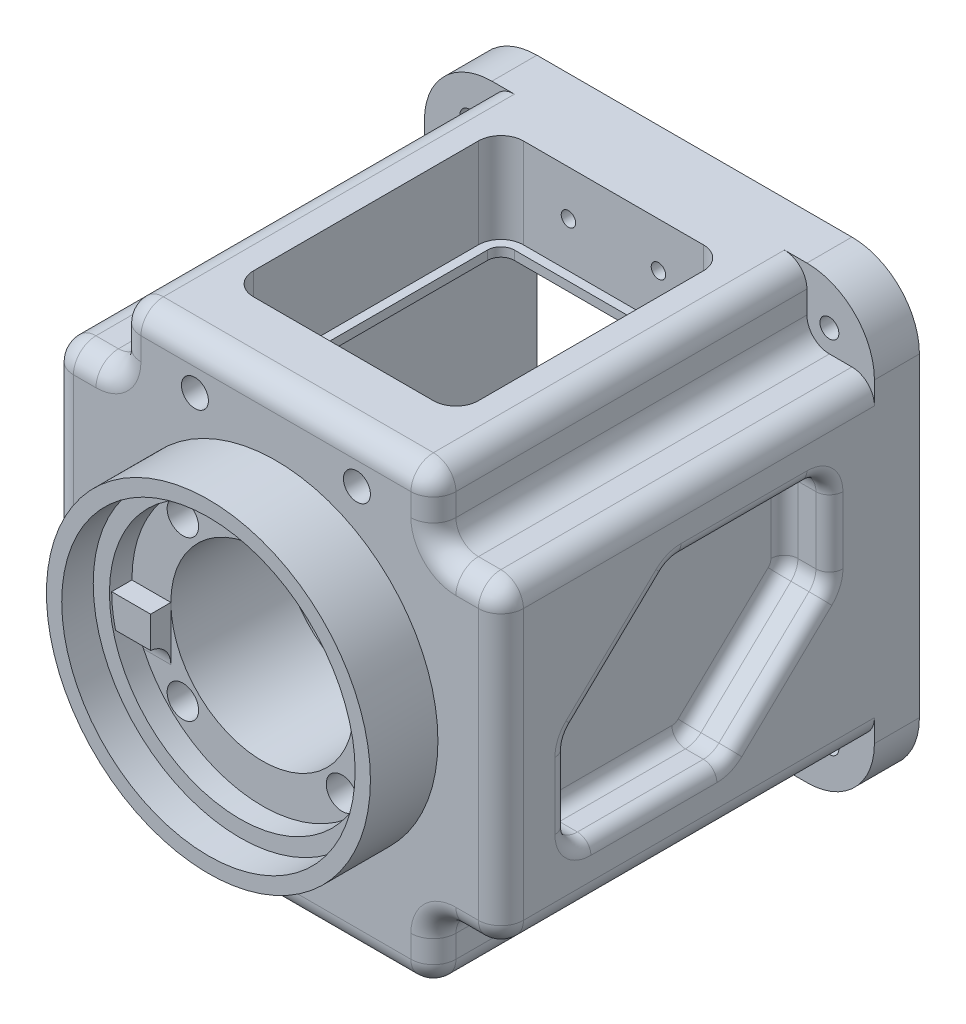
from build123d import *
from build123d.topology import SkipClean

# Parameters (mm, degrees)
SKETCH_1_W           = 100
SKETCH_1_H           = 100
EXTRUDE_1_DEPTH      = 93
FILLET_1_R           = 15
CUT_EXTRUDE_1_DEPTH  = 83
SKETCH_3_R           = 25
SKETCH_3_R_2         = 15
CUT_EXTRUDE_2_DEPTH  = 7
SKETCH_4_R           = 24
SKETCH_4_R_2         = 16
CUT_EXTRUDE_3_DEPTH  = 3
CHAMFER_1_SIZE       = 1
SKETCH_5_R           = 36
EXTRUDE_2_DEPTH      = 15
SKETCH_6_R           = 32.6
CUT_EXTRUDE_4_DEPTH  = 7
SKETCH_7_R           = 29
CUT_EXTRUDE_5_DEPTH  = 5
SKETCH_8_R           = 20.35
SKETCH_8_R_2         = 2.1
CUT_EXTRUDE_6_DEPTH  = 120.230868486
SKETCH_9_R           = 3.5
CUT_EXTRUDE_7_DEPTH  = 8
SKETCH_10_W          = 9
SKETCH_10_H          = 7
EXTRUDE_4_DEPTH      = 4.5
FILLET_2_R           = 5
CUT_EXTRUDE_8_DEPTH  = 88
FILLET_3_R           = 5
CUT_EXTRUDE_10_REACH = 157.448
CUT_EXTRUDE_11_DEPTH = 20
CUT_EXTRUDE_12_DEPTH = 10
FILLET_4_R           = 5
FILLET_5_R           = 3
SKETCH_16_R          = 2.1
CUT_EXTRUDE_13_DEPTH = 130.089116544
CUT_EXTRUDE_14_REACH = 151.211
CUT_EXTRUDE_15_REACH = 131.089
SKETCH_18_R          = 1.6
SKETCH_19_R          = 3
CUT_EXTRUDE_16_DEPTH = 10
SKETCH_20_R          = 1.6
CUT_EXTRUDE_17_DEPTH = 106.280577554
SKETCH_21_R          = 3
CUT_EXTRUDE_18_DEPTH = 8
SKETCH_12_W          = 45
SKETCH_12_H          = 45
SKETCH_12_R          = 20.35
SKETCH_12_R_2        = 2.1
EXTRUDE_5_DEPTH      = 17
SKETCH_22_R          = 7
CUT_EXTRUDE_19_DEPTH = 5


with BuildPart() as part:
    # 草图1 → 凸台-拉伸1 (new body)
    with BuildSketch(Plane.XY):
        Rectangle(SKETCH_1_W, SKETCH_1_H)
    extrude(amount=EXTRUDE_1_DEPTH)

    # 圆角1
    fillet_1_edges = [part.edges().sort_by_distance(p)[0] for p in [
        (50, -50, 46.5),
        (-50, -50, 46.5),
        (-50, 50, 46.5),
        (50, 50, 46.5),
    ]]
    fillet(fillet_1_edges, radius=FILLET_1_R)

    # 草图2 → 切除-拉伸1 (cut)
    with BuildSketch(Plane.XY.offset(93)):
        with BuildLine():
            Line((-35, 50), (-50, 50))
            Line((-50, 50), (-50, 35))
            Line((-50, 35), (-40, 35))
            ThreePointArc((-40, 35), (-36.464466094, 36.464466094), (-35, 40))
            Line((-35, 40), (-35, 50))
        make_face()
        with BuildLine():
            Line((50, 35), (40, 35))
            ThreePointArc((40, 35), (36.464466094, 36.464466094), (35, 40))
            Line((35, 40), (35, 50))
            Line((35, 50), (50, 50))
            Line((50, 50), (50, 35))
        make_face()
        with BuildLine():
            Line((35, -50), (35, -40))
            ThreePointArc((35, -40), (36.464466094, -36.464466094), (40, -35))
            Line((40, -35), (50, -35))
            Line((50, -35), (50, -50))
            Line((50, -50), (35, -50))
        make_face()
        with BuildLine():
            Line((-50, -35), (-40, -35))
            ThreePointArc((-40, -35), (-36.464466094, -36.464466094), (-35, -40))
            Line((-35, -40), (-35, -50))
            Line((-35, -50), (-50, -50))
            Line((-50, -50), (-50, -35))
        make_face()
    extrude(amount=-CUT_EXTRUDE_1_DEPTH, mode=Mode.SUBTRACT)

    # 草图3 → 切除-拉伸2 (cut)
    with BuildSketch(Plane.XZ.offset(50)):
        with Locations(Location((0, 46.5, 0), (0, 0, 270))):
            Circle(SKETCH_3_R)
        with Locations(Location((0, 46.5, 0), (0, 0, 270))):
            Circle(SKETCH_3_R_2, mode=Mode.SUBTRACT)
    extrude(amount=-CUT_EXTRUDE_2_DEPTH, mode=Mode.SUBTRACT)

    # 草图4 → 切除-拉伸3 (cut)
    with BuildSketch(Plane.XZ.offset(43)):
        with Locations(Location((0, 46.5, 0), (0, 0, 270))):
            Circle(SKETCH_4_R)
        with Locations(Location((0, 46.5, 0), (0, 0, 270))):
            Circle(SKETCH_4_R_2, mode=Mode.SUBTRACT)
    extrude(amount=-CUT_EXTRUDE_3_DEPTH, mode=Mode.SUBTRACT)

    # 倒角1
    chamfer_1_edges = [part.edges().sort_by_distance(p)[0] for p in [
        (0, -50, 71.5),
        (0, -50, 61.5),
    ]]
    chamfer(chamfer_1_edges, length=CHAMFER_1_SIZE)

    # 草图5 → 凸台-拉伸2 (add)
    with BuildSketch(Plane.XY.offset(93)):
        Circle(SKETCH_5_R)
    extrude(amount=EXTRUDE_2_DEPTH)

    # 草图6 → 切除-拉伸4 (cut)
    with BuildSketch(Plane.XY.offset(108)):
        Circle(SKETCH_6_R)
    extrude(amount=-CUT_EXTRUDE_4_DEPTH, mode=Mode.SUBTRACT)

    # 草图7 → 切除-拉伸5 (cut)
    with BuildSketch(Plane.XY.offset(101)):
        Circle(SKETCH_7_R)
    extrude(amount=-CUT_EXTRUDE_5_DEPTH, mode=Mode.SUBTRACT)

    # 草图8 → 切除-拉伸6 (cut, through all)
    with BuildSketch(Plane.XY.offset(96)):
        Circle(SKETCH_8_R)
        with Locations((-17.67766953, 17.67766953)):
            Circle(SKETCH_8_R_2)
        with Locations((17.67766953, 17.67766953)):
            Circle(SKETCH_8_R_2)
        with Locations((17.67766953, -17.67766953)):
            Circle(SKETCH_8_R_2)
        with Locations((-17.67766953, -17.67766953)):
            Circle(SKETCH_8_R_2)
    extrude(amount=-CUT_EXTRUDE_6_DEPTH, mode=Mode.SUBTRACT)

    # 草图9 → 切除-拉伸7 (cut)
    with BuildSketch(Plane.XY.offset(96)):
        with Locations((-17.67766953, 17.67766953)):
            Circle(SKETCH_9_R)
        with Locations((17.67766953, 17.67766953)):
            Circle(SKETCH_9_R)
        with Locations((-17.67766953, -17.67766953)):
            Circle(SKETCH_9_R)
        with Locations((17.67766953, -17.67766953)):
            Circle(SKETCH_9_R)
    extrude(amount=-CUT_EXTRUDE_7_DEPTH, mode=Mode.SUBTRACT)

    # 草图10 → 凸台-拉伸4 (add)
    with BuildSketch(Plane.XY.offset(96)):
        with Locations((-24.85, -3.5)):
            Rectangle(SKETCH_10_W, SKETCH_10_H)
    extrude(amount=EXTRUDE_4_DEPTH)

    # 圆角2
    # the kernel refuses this fillet: 5 mm, written as the material it adds along each edge
    with BuildSketch(Plane(origin=(-40.579837523, -7, 96), x_dir=(0, -1, 0), z_dir=(1, 0, 0))) as fillet_2_piece_1_section:
        with BuildLine():
            CenterArc((4.974937186, -5), FILLET_2_R, 90, 84.260829523)
            Line((0, -4.5), (0, 0))
            Line((0, 0), (4.974937186, 0))
        make_face()
    fillet_2_piece_1 = extrude(amount=20.229837523, mode=Mode.PRIVATE)
    fillet_2_piece_1 = fillet_2_piece_1 & Plane(origin=(0, 0, 97.284484558), x_dir=(1, 0, 0), z_dir=(0, 0, 1)) * Cylinder(29, 61, mode=Mode.PRIVATE)
    add(fillet_2_piece_1)

    # 草图11 → 切除-拉伸8 (cut)
    with BuildSketch(Plane(origin=(0, 0, 0), x_dir=(-1, 0, 0), z_dir=(0, 0, -1))):
        with BuildLine():
            Line((-25, 28), (25, 28))
            ThreePointArc((25, 28), (32.071067812, 25.071067812), (35, 18))
            Line((35, 18), (35, -27))
            ThreePointArc((35, -27), (32.071067812, -34.071067812), (25, -37))
            Line((25, -37), (-25, -37))
            ThreePointArc((-25, -37), (-32.071067812, -34.071067812), (-35, -27))
            Line((-35, -27), (-35, 18))
            ThreePointArc((-35, 18), (-32.071067812, 25.071067812), (-25, 28))
        make_face()
    extrude(amount=-CUT_EXTRUDE_8_DEPTH, mode=Mode.SUBTRACT)

    # 圆角3
    fillet_3_edges = [part.edges().sort_by_distance(p)[0] for p in [
        (0, -50, 93),
        (-35, -50, 51.5),
        (-50, 0, 93),
        (-50, 35, 51.5),
        (50, 0, 93),
        (0, 50, 93),
        (50, -35, 51.5),
        (35, 50, 51.5),
        (-50, -35, 51.5),
        (-45, -35, 93),
        (-35, -45, 93),
        (-36.464466094, -36.464466094, 93),
        (35, -50, 51.5),
        (35, -45, 93),
        (45, -35, 93),
        (36.464466094, -36.464466094, 93),
        (50, 35, 51.5),
        (45, 35, 93),
        (35, 45, 93),
        (36.464466094, 36.464466094, 93),
        (-35, 50, 51.5),
        (-35, 45, 93),
        (-45, 35, 93),
        (-36.464466094, 36.464466094, 93),
    ]]
    fillet(fillet_3_edges, radius=FILLET_3_R)

    # 草图13 → 切除-拉伸10 (cut, up to next)
    with BuildSketch(Plane(origin=(0, 50, 0), x_dir=(1, 0, 0), z_dir=(0, 1, 0)), mode=Mode.PRIVATE) as cut_extrude_10_sk1:
        with BuildLine():
            Line((-20, -20), (20, -20))
            ThreePointArc((20, -20), (22.121320344, -20.878679656), (23, -23))
            Line((23, -23), (23, -73))
            ThreePointArc((23, -73), (22.121320344, -75.121320344), (20, -76))
            Line((20, -76), (-20, -76))
            ThreePointArc((-20, -76), (-22.121320344, -75.121320344), (-23, -73))
            Line((-23, -73), (-23, -23))
            ThreePointArc((-23, -23), (-22.121320344, -20.878679656), (-20, -20))
        make_face()
    cut_extrude_10_tool1 = extrude(cut_extrude_10_sk1.sketch, amount=-CUT_EXTRUDE_10_REACH, mode=Mode.PRIVATE) & part.part
    add(cut_extrude_10_tool1.solids().sort_by_distance((0, 50, 48))[0], mode=Mode.SUBTRACT)

    # 草图14 → 切除-拉伸11 (cut)
    with BuildSketch(Plane(origin=(0, 50, 0), x_dir=(1, 0, 0), z_dir=(0, 1, 0))):
        with BuildLine():
            Line((-20, -18), (20, -18))
            ThreePointArc((20, -18), (23.535533906, -19.464466094), (25, -23))
            Line((25, -23), (25, -73))
            ThreePointArc((25, -73), (23.535533906, -76.535533906), (20, -78))
            Line((20, -78), (-20, -78))
            ThreePointArc((-20, -78), (-23.535533906, -76.535533906), (-25, -73))
            Line((-25, -73), (-25, -23))
            ThreePointArc((-25, -23), (-23.535533906, -19.464466094), (-20, -18))
        make_face()
    extrude(amount=-CUT_EXTRUDE_11_DEPTH, mode=Mode.SUBTRACT)

    # 草图15 → 切除-拉伸12 (cut)
    with BuildSketch(Plane.ZY.offset(50)):
        Polygon((78, -22), (78, 0), (55, 22), (20, 22), (20, 0), (43, -22), align=None)
    cut_extrude_12 = extrude(amount=-CUT_EXTRUDE_12_DEPTH, mode=Mode.SUBTRACT)

    # 镜向1: 切除-拉伸12 across plane
    add(cut_extrude_12.mirror(Plane(origin=(0, 0, 0), x_dir=(0, 0, 1), z_dir=(1, 0, 0))), mode=Mode.SUBTRACT)

    # 圆角4
    fillet_4_edges = [part.edges().sort_by_distance(p)[0] for p in [
        (-45, -22, 78),
        (-45, -22, 43),
        (-45, 0, 20),
        (-45, 22, 20),
        (-45, 22, 55),
        (-45, 0, 78),
        (45, -22, 43),
        (45, -22, 78),
        (45, 0, 78),
        (45, 22, 55),
        (45, 22, 20),
        (45, 0, 20),
    ]]
    fillet(fillet_4_edges, radius=FILLET_4_R)

    # 圆角5
    fillet_5_edges = [part.edges().sort_by_distance(p)[0] for p in [
        (50, -9.568224014, 78),
        (40, -9.568224014, 78),
        (50, 11.044985272, 66.452969943),
        (40, 11.044985272, 66.452969943),
        (40, -22, 59.003143287),
        (40, -11.044985272, 31.547030057),
        (40, 9.568224014, 20),
        (40, 22, 38.996856713),
        (40, -20.535533906, 76.535533906),
        (40, -21.640368866, 43.144304623),
        (40, 0.171831799, 20.402143644),
        (40, 20.535533906, 21.464466094),
        (40, 21.640368866, 54.855695377),
        (40, -0.171831799, 77.597856356),
        (50, 22, 38.996856713),
        (50, 9.568224014, 20),
        (50, -11.044985272, 31.547030057),
        (50, -22, 59.003143287),
        (-50, 9.568224014, 20),
        (-40, 9.568224014, 20),
        (-50, 22, 38.996856713),
        (-40, 22, 38.996856713),
        (-40, -22, 59.003143287),
        (-40, -9.568224014, 78),
        (-40, 11.044985272, 66.452969943),
        (-40, -11.044985272, 31.547030057),
        (-40, 21.640368866, 54.855695377),
        (-40, -0.171831799, 77.597856356),
        (-40, -20.535533906, 76.535533906),
        (-40, -21.640368866, 43.144304623),
        (-40, 0.171831799, 20.402143644),
        (-40, 20.535533906, 21.464466094),
        (-50, -11.044985272, 31.547030057),
        (-50, -22, 59.003143287),
        (-50, -9.568224014, 78),
        (-50, 11.044985272, 66.452969943),
        (50, -0.171831799, 77.597856356),
        (50, 21.640368866, 54.855695377),
        (50, 20.535533906, 21.464466094),
        (50, 0.171831799, 20.402143644),
        (50, -21.640368866, 43.144304623),
        (50, -20.535533906, 76.535533906),
        (-50, 20.535533906, 21.464466094),
        (-50, 0.171831799, 20.402143644),
        (-50, -21.640368866, 43.144304623),
        (-50, -20.535533906, 76.535533906),
        (-50, -0.171831799, 77.597856356),
        (-50, 21.640368866, 54.855695377),
    ]]
    fillet(fillet_5_edges, radius=FILLET_5_R)

    # 草图16 → 切除-拉伸13 (cut, through all)
    with BuildSketch(Plane(origin=(0, 0, 0), x_dir=(-1, 0, 0), z_dir=(0, 0, -1))):
        with Locations((-40, 40)):
            Circle(SKETCH_16_R)
        with Locations((40, 40)):
            Circle(SKETCH_16_R)
        with Locations((40, -40)):
            Circle(SKETCH_16_R)
        with Locations((-40, -40)):
            Circle(SKETCH_16_R)
    extrude(amount=-CUT_EXTRUDE_13_DEPTH, mode=Mode.SUBTRACT)

    # 草图17 → 切除-拉伸14 (cut, up to next)
    with BuildSketch(Plane.XZ.offset(40), mode=Mode.PRIVATE) as cut_extrude_14_sk1:
        with BuildLine():
            Line((22.2, 52.5), (22.2, 40.5))
            ThreePointArc((22.2, 40.5), (19, 37.3), (15.8, 40.5))
            Line((15.8, 40.5), (15.8, 52.5))
            ThreePointArc((15.8, 52.5), (19, 55.7), (22.2, 52.5))
        make_face()
    cut_extrude_14_tool1 = extrude(cut_extrude_14_sk1.sketch, amount=-CUT_EXTRUDE_14_REACH, mode=Mode.PRIVATE) & part.part
    add(cut_extrude_14_tool1.solids().sort_by_distance((19, -40, 46.5))[0], mode=Mode.SUBTRACT)

    # 草图18 → 切除-拉伸15 (cut, up to next)
    with BuildSketch(Plane(origin=(0, 0, 0), x_dir=(-1, 0, 0), z_dir=(0, 0, -1)), mode=Mode.PRIVATE) as cut_extrude_15_sk1:
        with Locations((-10, 40)):
            Circle(SKETCH_18_R)
    cut_extrude_15_tool1 = extrude(cut_extrude_15_sk1.sketch, amount=-CUT_EXTRUDE_15_REACH, mode=Mode.PRIVATE) & part.part
    # 草图18 → 切除-拉伸15 (cut, up to next)
    with BuildSketch(Plane(origin=(0, 0, 0), x_dir=(-1, 0, 0), z_dir=(0, 0, -1)), mode=Mode.PRIVATE) as cut_extrude_15_sk2:
        with Locations((10, 40)):
            Circle(SKETCH_18_R)
    cut_extrude_15_tool2 = extrude(cut_extrude_15_sk2.sketch, amount=-CUT_EXTRUDE_15_REACH, mode=Mode.PRIVATE) & part.part
    add(cut_extrude_15_tool1.solids().sort_by_distance((10, 40, 0))[0], mode=Mode.SUBTRACT)
    add(cut_extrude_15_tool2.solids().sort_by_distance((-10, 40, 0))[0], mode=Mode.SUBTRACT)

    # 草图19 → 切除-拉伸16 (cut)
    with BuildSketch(Plane(origin=(0, 0, 0), x_dir=(-1, 0, 0), z_dir=(0, 0, -1))):
        with Locations((-10, 40)):
            Circle(SKETCH_19_R)
        with Locations((10, 40)):
            Circle(SKETCH_19_R)
    extrude(amount=-CUT_EXTRUDE_16_DEPTH, mode=Mode.SUBTRACT)

    # 草图20 → 切除-拉伸17 (cut, through all)
    with BuildSketch(Plane(origin=(0, 0, 78), x_dir=(-1, 0, 0), z_dir=(0, 0, -1))):
        with Locations((-18, 40)):
            Circle(SKETCH_20_R)
        with Locations((18, 40)):
            Circle(SKETCH_20_R)
    extrude(amount=-CUT_EXTRUDE_17_DEPTH, mode=Mode.SUBTRACT)

    # 草图21 → 切除-拉伸18 (cut)
    with BuildSketch(Plane.XY.offset(93)):
        with Locations((-18, 40)):
            Circle(SKETCH_21_R)
        with Locations((18, 40)):
            Circle(SKETCH_21_R)
    extrude(amount=-CUT_EXTRUDE_18_DEPTH, mode=Mode.SUBTRACT)

    # 草图12 → 凸台-拉伸5 (add)
    with SkipClean():  # the faces are left unmerged after this step: merging them gives an invalid solid
        with BuildSketch(Plane(origin=(0, 0, 88), x_dir=(-1, 0, 0), z_dir=(0, 0, -1))):
            Rectangle(SKETCH_12_W, SKETCH_12_H)
            Circle(SKETCH_12_R, mode=Mode.SUBTRACT)
            with Locations((-17.67766953, 17.67766953)):
                Circle(SKETCH_12_R_2, mode=Mode.SUBTRACT)
            with Locations((17.67766953, 17.67766953)):
                Circle(SKETCH_12_R_2, mode=Mode.SUBTRACT)
            with Locations((17.67766953, -17.67766953)):
                Circle(SKETCH_12_R_2, mode=Mode.SUBTRACT)
            with Locations((-17.67766953, -17.67766953)):
                Circle(SKETCH_12_R_2, mode=Mode.SUBTRACT)
        extrude(amount=EXTRUDE_5_DEPTH)

    # 草图22 → 切除-拉伸19 (cut)
    with SkipClean():  # the faces are left unmerged after this step: merging them gives an invalid solid
        with BuildSketch(Plane(origin=(0, 0, 71), x_dir=(-1, 0, 0), z_dir=(0, 0, -1))):
            with Locations((-17.67766953, -17.67766953)):
                Circle(SKETCH_22_R)
            with Locations((17.67766953, 17.67766953)):
                Circle(SKETCH_22_R)
        extrude(amount=-CUT_EXTRUDE_19_DEPTH, mode=Mode.SUBTRACT)


solid = part.part
